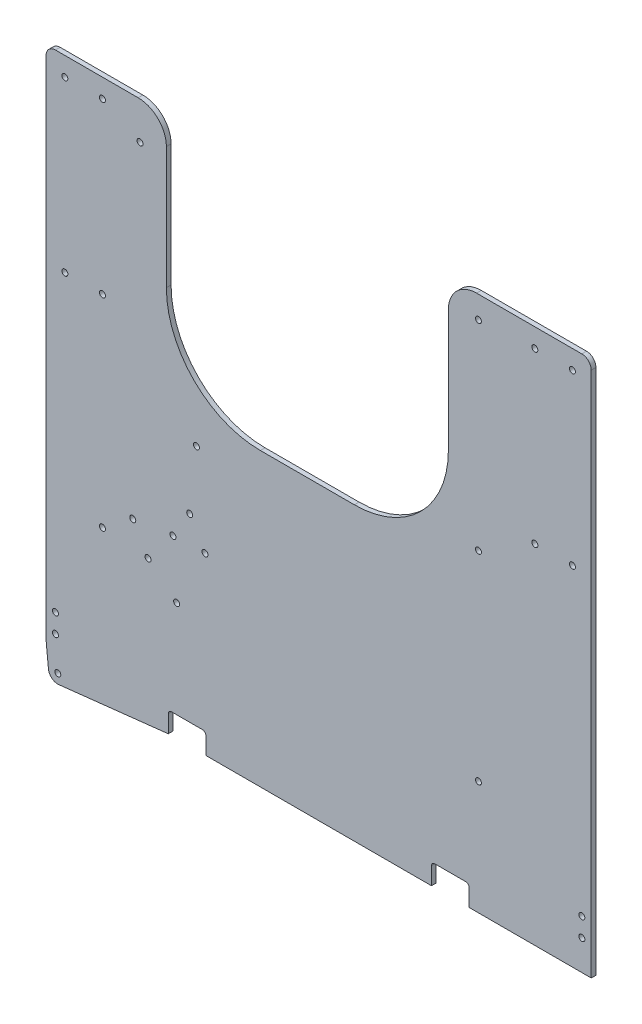
from build123d import *

# Parameters (mm, degrees)
SKETCH1_R           = 2.032
SKETCH1_R_2         = 2
BOSS_EXTRUDE1_DEPTH = 3.175
FILLET1_R           = 2.286
FILLET2_R           = 6.35
FILLET3_R           = 19.05
FILLET4_R           = 63.5


with BuildPart() as part:
    # Sketch1 → Boss-Extrude1 (new body)
    with BuildSketch(Plane.XY):
        with BuildLine():
            Line((8.639060666, -28.536126099), (82.55, -20.32))
            Line((82.55, -20.32), (82.55, -6.35))
            Line((82.55, -6.35), (107.95, -6.35))
            Line((107.95, -6.35), (107.95, -20.32))
            Line((107.95, -20.32), (260.35, -20.32))
            Line((260.35, -20.32), (260.35, -6.35))
            Line((260.35, -6.35), (285.75, -6.35))
            Line((285.75, -6.35), (285.75, -20.32))
            Line((285.75, -20.32), (368.3, -20.32))
            Line((368.3, -20.32), (368.3, 341.63))
            Line((368.3, 341.63), (271.78, 341.63))
            Line((271.78, 341.63), (271.78, 176.53))
            Line((271.78, 176.53), (81.28, 176.53))
            Line((81.28, 176.53), (81.28, 341.63))
            Line((81.28, 341.63), (0, 341.63))
            Line((0, 341.63), (0, 0))
            Line((0, 0), (0, -6.35))
            ThreePointArc((0, -6.35), (0.007883354, -6.666317007), (0.031513842, -6.981848616))
            Line((0.031513842, -6.981848616), (1.619013842, -22.856848616))
            ThreePointArc((1.619013842, -22.856848616), (3.943628298, -27.161748811), (8.639060666, -28.536126099))
        make_face()
        with Locations((7.9375, -22.225)):
            Circle(SKETCH1_R, mode=Mode.SUBTRACT)
        with Locations((6.35, 0)):
            Circle(SKETCH1_R, mode=Mode.SUBTRACT)
        with Locations((6.35, 12.7)):
            Circle(SKETCH1_R, mode=Mode.SUBTRACT)
        with Locations((88.216909404, 59.136578314)):
            Circle(SKETCH1_R, mode=Mode.SUBTRACT)
        with Locations((38.1, 78.105)):
            Circle(SKETCH1_R, mode=Mode.SUBTRACT)
        with Locations((68.887329744, 75.518700365)):
            Circle(SKETCH1_R, mode=Mode.SUBTRACT)
        with Locations((58.568579744, 93.391299635)):
            Circle(SKETCH1_R, mode=Mode.SUBTRACT)
        with Locations((85.725, 97.155)):
            Circle(SKETCH1_R, mode=Mode.SUBTRACT)
        with Locations((107.382158942, 97.743700365)):
            Circle(SKETCH1_R, mode=Mode.SUBTRACT)
        with Locations((97.063408942, 115.616299635)):
            Circle(SKETCH1_R, mode=Mode.SUBTRACT)
        with Locations((361.95, 0)):
            Circle(SKETCH1_R, mode=Mode.SUBTRACT)
        with Locations((361.95, 12.7)):
            Circle(SKETCH1_R, mode=Mode.SUBTRACT)
        with Locations((292.1, 56.63)):
            Circle(SKETCH1_R_2, mode=Mode.SUBTRACT)
        with Locations((12.7, 214.63)):
            Circle(SKETCH1_R, mode=Mode.SUBTRACT)
        with Locations((38.1, 214.63)):
            Circle(SKETCH1_R, mode=Mode.SUBTRACT)
        with Locations((101.6, 157.48)):
            Circle(SKETCH1_R, mode=Mode.SUBTRACT)
        with Locations((12.7, 328.93)):
            Circle(SKETCH1_R, mode=Mode.SUBTRACT)
        with Locations((38.1, 328.93)):
            Circle(SKETCH1_R, mode=Mode.SUBTRACT)
        with Locations((63.5, 316.23)):
            Circle(SKETCH1_R, mode=Mode.SUBTRACT)
        with Locations((292.1, 191.63)):
            Circle(SKETCH1_R_2, mode=Mode.SUBTRACT)
        with Locations((330.2, 214.63)):
            Circle(SKETCH1_R, mode=Mode.SUBTRACT)
        with Locations((355.6, 214.63)):
            Circle(SKETCH1_R, mode=Mode.SUBTRACT)
        with Locations((292.1, 326.63)):
            Circle(SKETCH1_R_2, mode=Mode.SUBTRACT)
        with Locations((330.2, 328.93)):
            Circle(SKETCH1_R, mode=Mode.SUBTRACT)
        with Locations((355.6, 328.93)):
            Circle(SKETCH1_R, mode=Mode.SUBTRACT)
    extrude(amount=BOSS_EXTRUDE1_DEPTH)

    # Fillet1
    fillet1_edges = [part.edges().sort_by_distance(p)[0] for p in [
        (285.75, -6.35, 1.5875),
        (107.95, -6.35, 1.5875),
        (260.35, -6.35, 1.5875),
        (82.55, -6.35, 1.5875),
    ]]
    fillet(fillet1_edges, radius=FILLET1_R)

    # Fillet2
    fillet2_edges = [part.edges().sort_by_distance(p)[0] for p in [
        (368.3, 341.63, 1.5875),
        (0, 341.63, 1.5875),
    ]]
    fillet(fillet2_edges, radius=FILLET2_R)

    # Fillet3
    fillet3_edges = [part.edges().sort_by_distance(p)[0] for p in [
        (271.78, 341.63, 1.5875),
        (81.28, 341.63, 1.5875),
    ]]
    fillet(fillet3_edges, radius=FILLET3_R)

    # Fillet4
    fillet4_edges = [part.edges().sort_by_distance(p)[0] for p in [
        (271.78, 176.53, 1.5875),
        (81.28, 176.53, 1.5875),
    ]]
    fillet(fillet4_edges, radius=FILLET4_R)


solid = part.part
